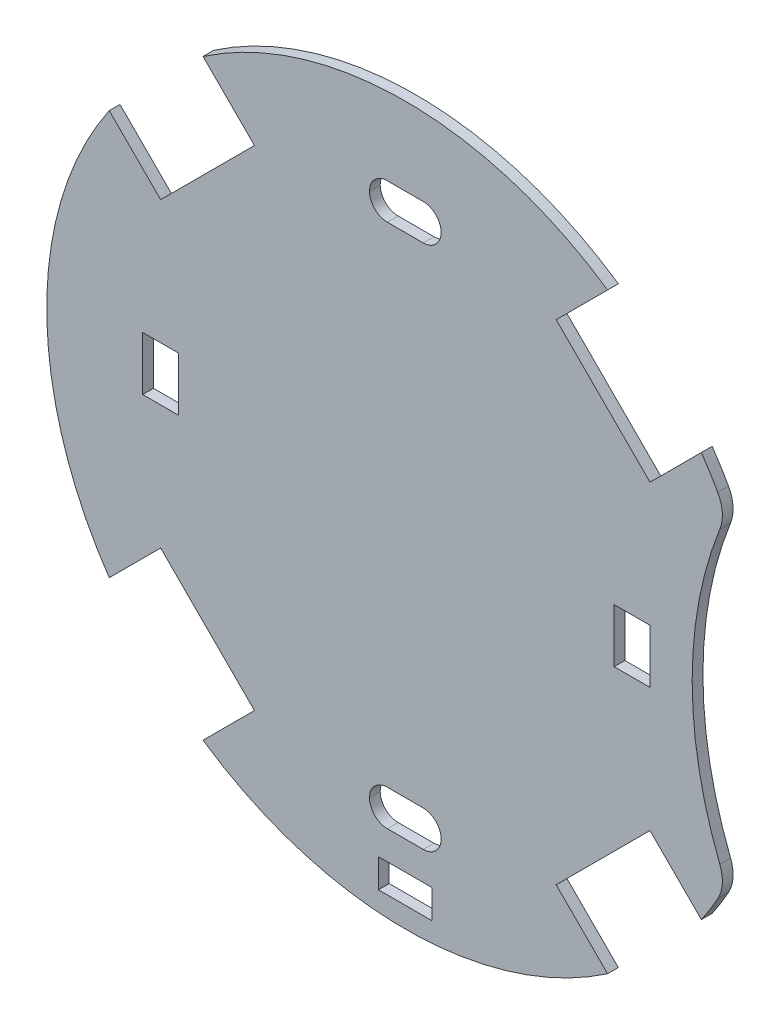
from build123d import *

# Parameters (mm, degrees)
CROQUIS1_R              = 100
SALIENTE_EXTRUIR1_DEPTH = 3
CROQUIS3_R              = 110
CORTAR_EXTRUIR1_DEPTH   = 3
REDONDEO1_R             = 10
CORTAR_EXTRUIR2_DEPTH   = 142.453172607
CROQUIS6_W              = 10
CROQUIS6_H              = 15
CROQUIS6_W_2            = 20
CROQUIS6_H_2            = 10
CROQUIS6_W_3            = 15
CROQUIS6_H_3            = 8
CORTAR_EXTRUIR4_DEPTH   = 10
REDONDEO3_R             = 5


with BuildPart() as part:
    # Croquis1 → Saliente-Extruir1 (new body)
    with BuildSketch(Plane.XY):
        Circle(CROQUIS1_R)
    extrude(amount=SALIENTE_EXTRUIR1_DEPTH)

    # Croquis3 → Cortar-Extruir1 (cut)
    with BuildSketch(Plane.XY.offset(3)):
        with Locations((190, 0)):
            Circle(CROQUIS3_R)
    extrude(amount=-CORTAR_EXTRUIR1_DEPTH, mode=Mode.SUBTRACT)

    # Redondeo1
    redondeo1_edges = [part.edges().sort_by_distance(p)[0] for p in [
        (89.473684211, -44.659375654, 1.5),
        (89.473684211, 44.659375654, 1.5),
    ]]
    fillet(redondeo1_edges, radius=REDONDEO1_R)

    # Croquis4 → Cortar-Extruir2 (cut, through all)
    with BuildSketch(Plane.XY.offset(3)):
        Polygon((-57.629202667, -83.792153571), (-83.792153571, -57.629202667), (-68.235804385, -42.072853481), (-42.072853481, -68.235804385), align=None)
        Polygon((-57.629202667, 83.792153571), (-42.072853481, 68.235804385), (-68.235804385, 42.072853481), (-83.792153571, 57.629202667), align=None)
        Polygon((83.792153571, 57.629202667), (68.235804385, 42.072853481), (42.072853481, 68.235804385), (57.629202667, 83.792153571), align=None)
        Polygon((57.629202667, -83.792153571), (42.072853481, -68.235804385), (68.235804385, -42.072853481), (83.792153571, -57.629202667), align=None)
    extrude(amount=-CORTAR_EXTRUIR2_DEPTH, mode=Mode.SUBTRACT)

    # Croquis6 → Cortar-Extruir4 (cut)
    with BuildSketch(Plane.XY.offset(3)):
        with Locations((63.24, 0)):
            Rectangle(CROQUIS6_W, CROQUIS6_H)
        with Locations((-68.235804385, 0)):
            Rectangle(CROQUIS6_W, CROQUIS6_H)
        with Locations((0, 73.24)):
            Rectangle(CROQUIS6_W_2, CROQUIS6_H_2)
        with Locations((0, -73.24)):
            Rectangle(CROQUIS6_W_2, CROQUIS6_H_2)
        with Locations((0, -90.24)):
            Rectangle(CROQUIS6_W_3, CROQUIS6_H_3)
    extrude(amount=-CORTAR_EXTRUIR4_DEPTH, mode=Mode.SUBTRACT)

    # Redondeo3
    redondeo3_edges = [part.edges().sort_by_distance(p)[0] for p in [
        (10, 68.24, 1.5),
        (-10, 68.24, 1.5),
        (10, 78.24, 1.5),
        (-10, 78.24, 1.5),
        (10, -78.24, 1.5),
        (-10, -78.24, 1.5),
        (10, -68.24, 1.5),
        (-10, -68.24, 1.5),
    ]]
    fillet(redondeo3_edges, radius=REDONDEO3_R - 0.0001)  # a hair under: the kernel refuses the full size


solid = part.part
